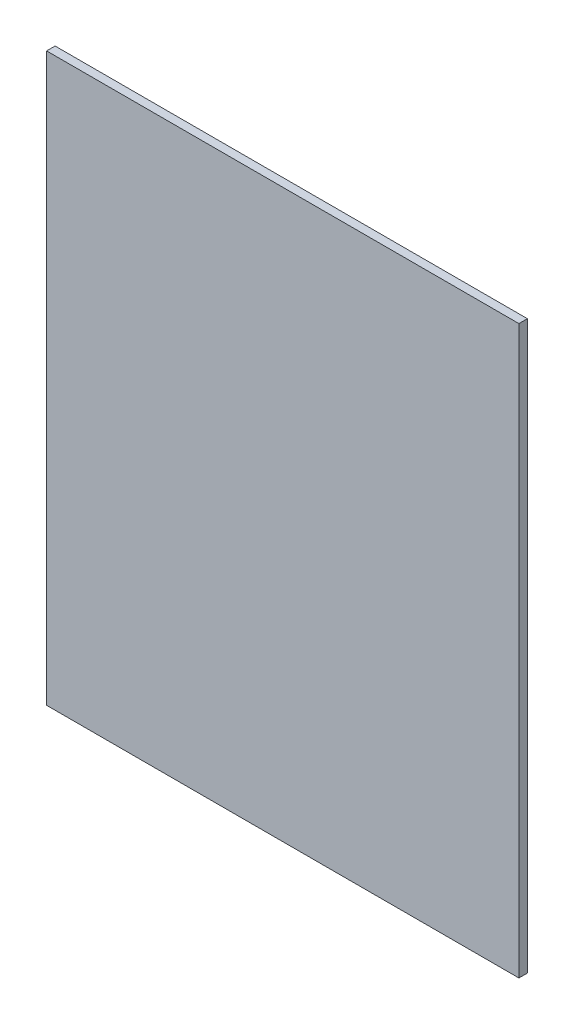
from build123d import *

# Parameters (mm, degrees)
SKETCH1_W           = 1016
SKETCH1_H           = 1219.2
BOSS_EXTRUDE1_DEPTH = 18.25625


with BuildPart() as part:
    # Sketch1 → Boss-Extrude1 (new body)
    with BuildSketch(Plane.XY):
        with Locations((463.596884963, -68.887712199)):
            Rectangle(SKETCH1_W, SKETCH1_H)
    extrude(amount=BOSS_EXTRUDE1_DEPTH)


solid = part.part
